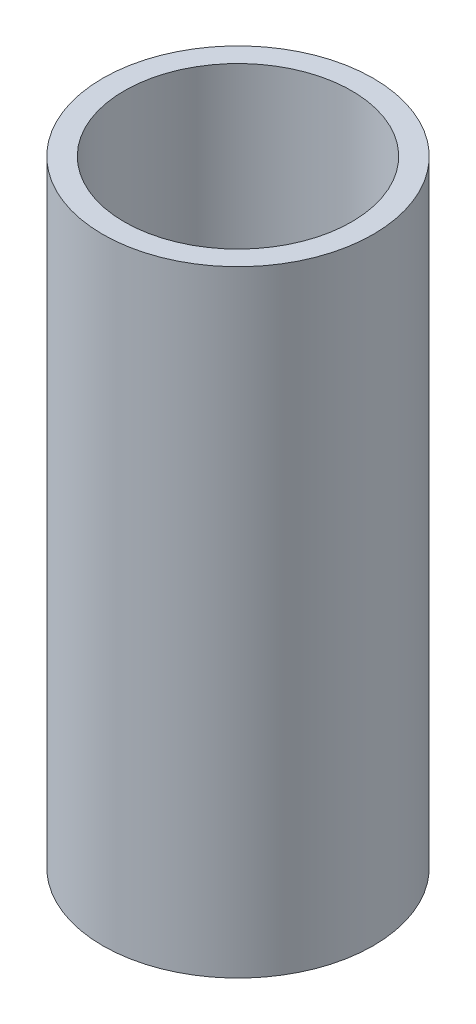
from build123d import *

# Parameters (mm, degrees)
SKETCH1_R           = 32.5
BOSS_EXTRUDE1_DEPTH = 148.045834831
SKETCH2_R           = 27.312066841
CUT_EXTRUDE1_DEPTH  = 156.016351431


with BuildPart() as part:
    # Sketch1 → Boss-Extrude1 (new body)
    with BuildSketch(Plane(origin=(0, 0, 0), x_dir=(1, 0, 0), z_dir=(0, 1, 0))):
        Circle(SKETCH1_R)
    extrude(amount=BOSS_EXTRUDE1_DEPTH)

    # Sketch2 → Cut-Extrude1 (cut, through all)
    with BuildSketch(Plane(origin=(0, 0, 0), x_dir=(1, 0, 0), z_dir=(0, 1, 0))):
        Circle(SKETCH2_R)
    extrude(amount=CUT_EXTRUDE1_DEPTH, mode=Mode.SUBTRACT)


solid = part.part
